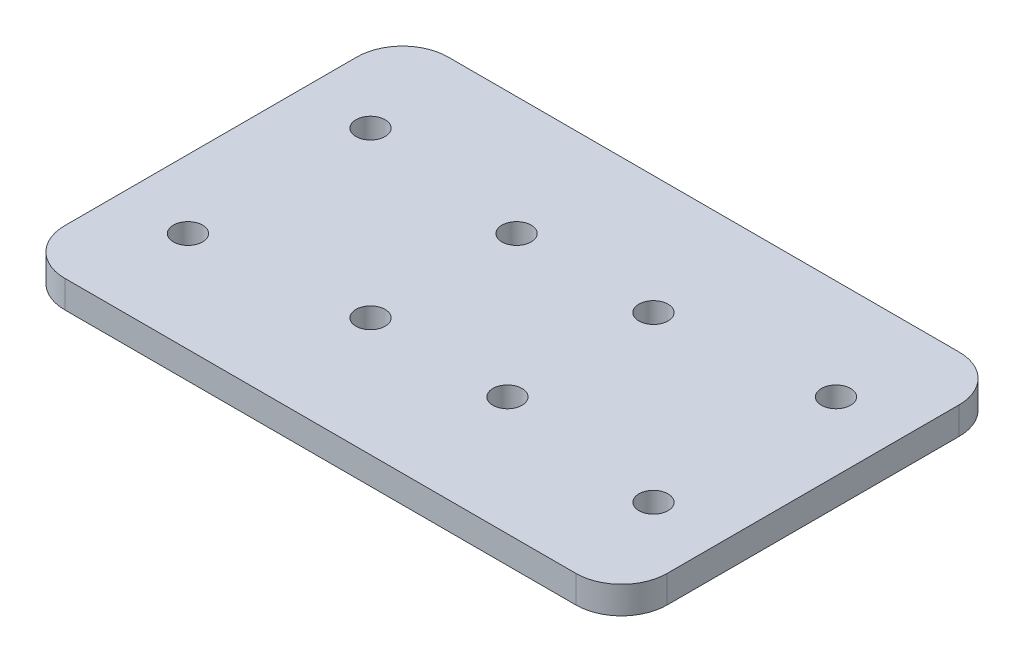
from build123d import *

# Parameters (mm, degrees)
SKETCH1_W           = 66
SKETCH1_H           = 42
SKETCH1_R           = 1.6
BOSS_EXTRUDE1_DEPTH = 3
SKETCH2_R           = 1.6
CUT_EXTRUDE1_DEPTH  = 79.287930104
FILLET1_R           = 5


with BuildPart() as part:
    # Sketch1 → Boss-Extrude1 (new body)
    with BuildSketch(Plane(origin=(0, 0, 0), x_dir=(1, 0, 0), z_dir=(0, 1, 0))):
        with Locations((33, 21)):
            Rectangle(SKETCH1_W, SKETCH1_H)
        with Locations((7.5, 31)):
            Circle(SKETCH1_R, mode=Mode.SUBTRACT)
        with Locations((7.5, 11)):
            Circle(SKETCH1_R, mode=Mode.SUBTRACT)
        with Locations((58.5, 11)):
            Circle(SKETCH1_R, mode=Mode.SUBTRACT)
        with Locations((58.5, 31)):
            Circle(SKETCH1_R, mode=Mode.SUBTRACT)
    extrude(amount=BOSS_EXTRUDE1_DEPTH)

    # Sketch2 → Cut-Extrude1 (cut, through all)
    with BuildSketch(Plane(origin=(0, 3, 0), x_dir=(1, 0, 0), z_dir=(0, 1, 0))):
        with Locations((40.5, 29)):
            Circle(SKETCH2_R)
        with Locations((40.5, 13)):
            Circle(SKETCH2_R)
        with Locations((25.5, 13)):
            Circle(SKETCH2_R)
        with Locations((25.5, 29)):
            Circle(SKETCH2_R)
    extrude(amount=-CUT_EXTRUDE1_DEPTH, mode=Mode.SUBTRACT)

    # Fillet1
    fillet1_edges = [part.edges().sort_by_distance(p)[0] for p in [
        (0, 1.5, -42),
        (66, 1.5, -42),
        (66, 1.5, 0),
        (0, 1.5, 0),
    ]]
    fillet(fillet1_edges, radius=FILLET1_R)


solid = part.part
